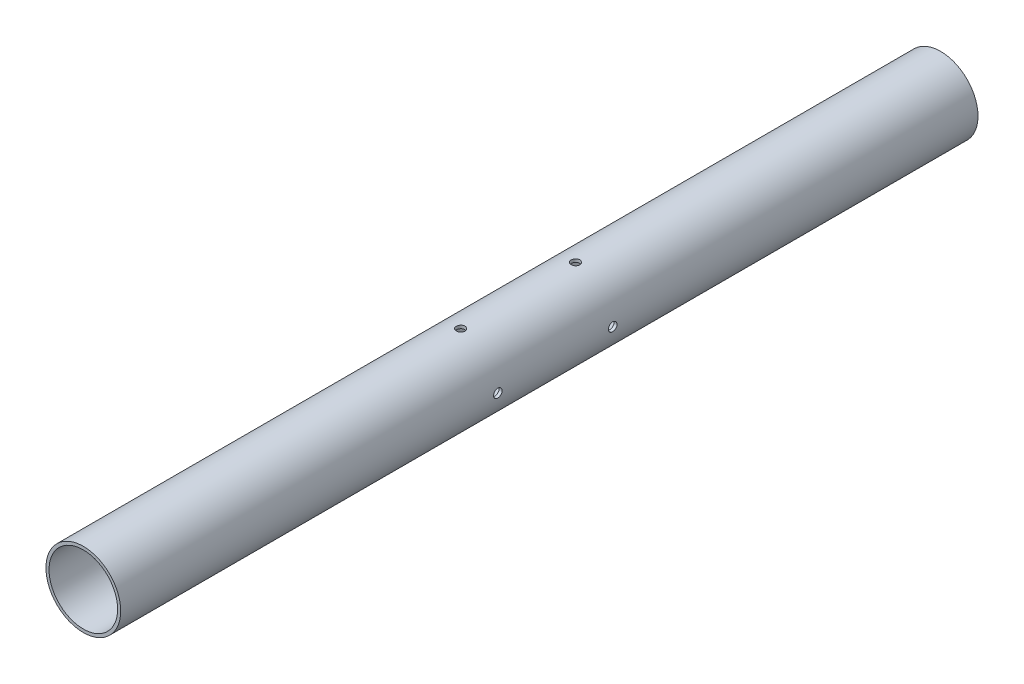
from build123d import *

# Parameters (mm, degrees)
SKETCH2_R          = 27.686
SKETCH2_R_2        = 25.4
TUBE_EXTRUDE_DEPTH = 635
BOLTHOLES_REACH    = 640.011
SKETCH4_R          = 3.175
CIRPATTERN2_COUNT  = 4


with BuildPart() as part:
    # Sketch2 → tube_extrude (new body)
    with BuildSketch(Plane(origin=(0, 0, 0), x_dir=(0, 1, 0), z_dir=(0, 0, 1))):
        Circle(SKETCH2_R)
        Circle(SKETCH2_R_2, mode=Mode.SUBTRACT)
    extrude(amount=TUBE_EXTRUDE_DEPTH)

    # Sketch4 → boltholes (cut, up to next)
    with BuildSketch(Plane.ZY.offset(27.686), mode=Mode.PRIVATE) as boltholes_sk1:
        with Locations((355.6, 0)):
            Circle(SKETCH4_R)
    boltholes_tool1 = extrude(boltholes_sk1.sketch, amount=-BOLTHOLES_REACH, mode=Mode.PRIVATE) & part.part
    # Sketch4 → boltholes (cut, up to next)
    with BuildSketch(Plane.ZY.offset(27.686), mode=Mode.PRIVATE) as boltholes_sk2:
        with Locations((270.51, 0)):
            Circle(SKETCH4_R)
    boltholes_tool2 = extrude(boltholes_sk2.sketch, amount=-BOLTHOLES_REACH, mode=Mode.PRIVATE) & part.part
    boltholes_1 = boltholes_tool1.solids().sort_by_distance((-27.686, 0, 355.6))[0]
    add(boltholes_1, mode=Mode.SUBTRACT)
    boltholes_2 = boltholes_tool2.solids().sort_by_distance((-27.686, 0, 270.51))[0]
    add(boltholes_2, mode=Mode.SUBTRACT)
    boltholes = boltholes_1 + boltholes_2  # boltholes as one shape, for the pattern or mirror that repeats it

    # CirPattern2: boltholes ×4 about axis
    cirpattern2_axis = Axis((0, 0, 635), (0, 0, -1))
    for i in range(1, CIRPATTERN2_COUNT):
        add(boltholes.rotate(cirpattern2_axis, i * 360 / CIRPATTERN2_COUNT), mode=Mode.SUBTRACT)


solid = part.part
